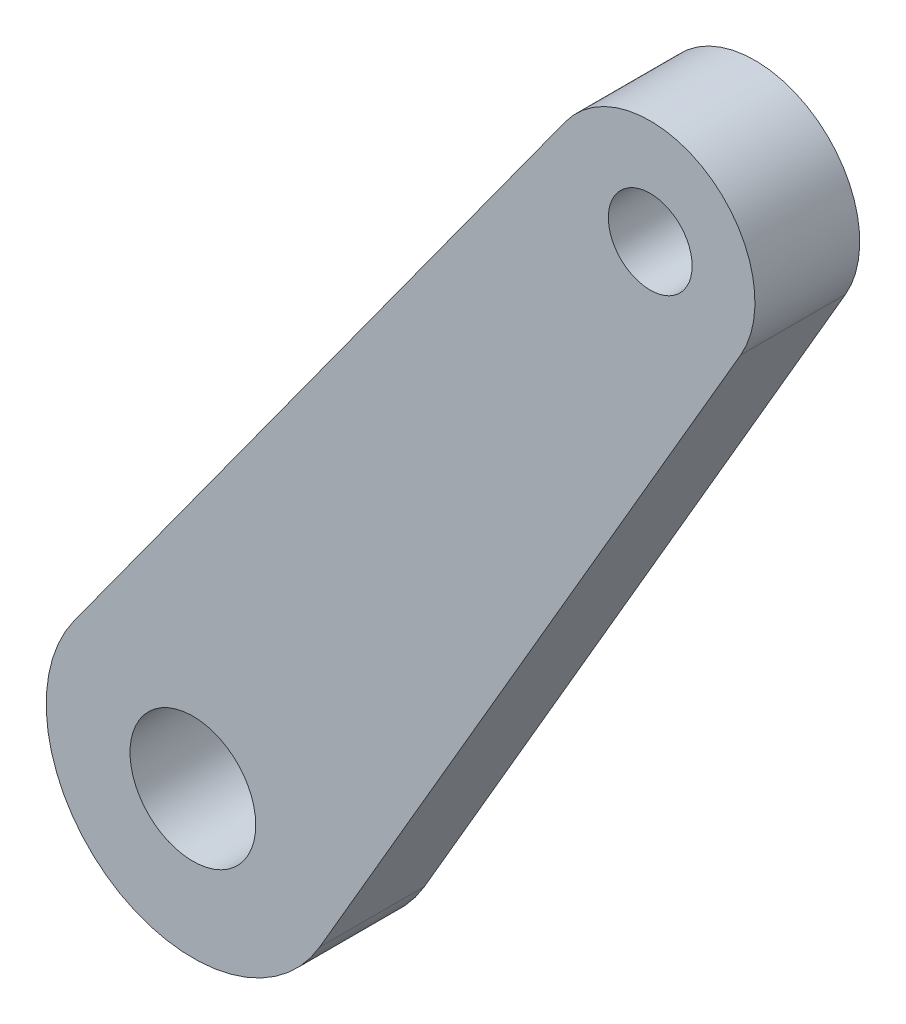
from build123d import *

# Parameters (mm, degrees)
BOSS_EXTRUDE1_START = 10
SKETCH1_R           = 3
SKETCH1_R_2         = 2
BOSS_EXTRUDE1_DEPTH = 5


with BuildPart() as part:
    # Sketch1 → Boss-Extrude1 (new body)
    with BuildSketch(Plane.XY.offset(BOSS_EXTRUDE1_START)):
        with BuildLine():
            Line((-65.66773798, 14.108131715), (-42.222061768, 46.45469671))
            ThreePointArc((-42.222061768, 46.45469671), (-35.445387184, 47.710356528), (-33.852464194, 41.004941078))
            Line((-33.852464194, 41.004941078), (-53.950301376, 6.478473831))
            ThreePointArc((-53.950301376, 6.478473831), (-63.819606438, 4.13394454), (-65.66773798, 14.108131715))
        make_face()
        with Locations((-60, 10)):
            Circle(SKETCH1_R, mode=Mode.SUBTRACT)
        with Locations((-38.173677497, 43.520316913)):
            Circle(SKETCH1_R_2, mode=Mode.SUBTRACT)
    extrude(amount=BOSS_EXTRUDE1_DEPTH)


solid = part.part
